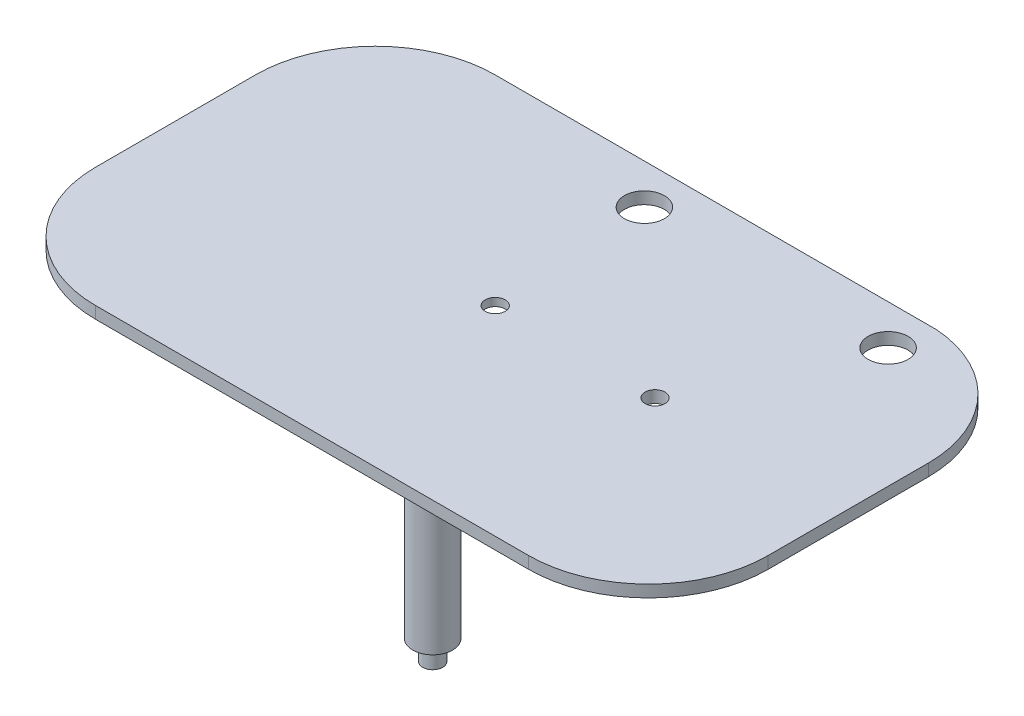
from build123d import *

# Parameters (mm, degrees)
EXTRUDE_1_DEPTH           = 50
EXTRUDE_1_DEPTH_BACK      = 50
SKETCH_2_W                = 200
SKETCH_2_H                = 100
EXTRUDE_2_DEPTH           = 40
SKETCH_3_W                = 200
SKETCH_3_H                = 34
CUT_EXTRUDE_1_DEPTH       = 100
CUT_EXTRUDE_2_DEPTH       = 279.66871012
SKETCH_8_R                = 2.5
CUT_EXTRUDE_4_DEPTH       = 276.238532913
SKETCH_10_R               = 5
CUT_EXTRUDE_5_DEPTH       = 260.608358879
EXTRUDE_5_DEPTH           = 10
SKETCH_13_W               = 74.115787845
SKETCH_13_H               = 3
EXTRUDE_7_DEPTH           = 81
SKETCH_14_W               = 207.5
SKETCH_14_H               = 100
EXTRUDE_8_DEPTH           = 7
EXTRUDE_9_DEPTH           = 10
SKETCH_17_R               = 6.35
CUT_EXTRUDE_6_DEPTH       = 1
CUT_EXTRUDE_START         = -1
SKETCH_18_R               = 6.35
CUT_EXTRUDE_7_DEPTH       = 1
SKETCH_20_R               = 5
CUT_EXTRUDE_8_DEPTH       = 3
CUT_EXTRUDE_9_DEPTH       = 273.255129638
CUT_EXTRUDE_9_DEPTH_BACK  = 273.255129638
SKETCH_21_W               = 31.665374736
SKETCH_21_H               = 100
SKETCH_22_R               = 5
EXTRUDE_10_DEPTH          = 37
FILLET_1_R                = 30
FILLET_2_R                = 30
CUT_EXTRUDE_10_DEPTH      = 248.444254611
CUT_EXTRUDE_10_DEPTH_BACK = 248.444254611
CUT_EXTRUDE_11_DEPTH      = 211.689689342
CUT_EXTRUDE_11_DEPTH_BACK = 211.689689342
CUT_EXTRUDE_12_DEPTH      = 174.368632309
CUT_EXTRUDE_12_DEPTH_BACK = 174.368632309
SKETCH_26_R               = 5
CUT_EXTRUDE_13_DEPTH      = 153.295269567
CUT_EXTRUDE_13_DEPTH_BACK = 153.295269567
CUT_EXTRUDE_14_DEPTH      = 160.286168691
CUT_EXTRUDE_14_DEPTH_BACK = 160.286168691
SKETCH_30_R               = 7.5
CUT_EXTRUDE_15_DEPTH      = 160.286168691
CUT_EXTRUDE_15_DEPTH_BACK = 160.286168691
SKETCH_31_R               = 7.5
SKETCH_31_R_2             = 5
SKETCH_32_R               = 7.5
SKETCH_32_R_2             = 5
EXTRUDE_12_DEPTH          = 3
SKETCH_33_R               = 7.5
SKETCH_33_R_2             = 5
EXTRUDE_13_DEPTH          = 3
SKETCH_34_R               = 5
EXTRUDE_14_DEPTH          = 45
CUT_EXTRUDE_17_DEPTH      = 178.031776809
CUT_EXTRUDE_17_DEPTH_BACK = 178.031776809
SKETCH_37_W               = 132.207085757
SKETCH_37_H               = 67.753693261
EXTRUDE_19_DEPTH          = 34
SKETCH_44_R               = 2.5
EXTRUDE_20_DEPTH          = 5
SKETCH_41_R               = 7.5
SKETCH_41_R_2             = 5
EXTRUDE_17_DEPTH          = 3
SKETCH_42_R               = 7.5
SKETCH_42_R_2             = 5
EXTRUDE_18_DEPTH          = 3


with BuildPart() as part:
    # 草图1 → 凸台-拉伸1 (new, two sides: drawn at the far end of the back side and taken through both)
    with BuildSketch(Plane(origin=(0, 0, 0), x_dir=(1, 0, 0), z_dir=(0, 1, 0)).offset(-EXTRUDE_1_DEPTH_BACK)):
        Polygon((9.5, 12.5), (9.5, 0), (90.5, 0), (90.5, 12.5), (90.5, 212.5), (9.5, 212.5), align=None)
    extrude(amount=EXTRUDE_1_DEPTH + EXTRUDE_1_DEPTH_BACK)

    # 草图2 → 凸台-拉伸2 (add)
    with BuildSketch(Plane(origin=(0, 0, 0), x_dir=(-1, 0, 0), z_dir=(0, -1, 0))):
        with Locations((-50, -50)):
            Rectangle(SKETCH_2_W, SKETCH_2_H)
    extrude(amount=-EXTRUDE_2_DEPTH)

    # 草图3 → 切除-拉伸1 (cut)
    with BuildSketch(Plane.XY.offset(100)):
        with Locations((50, 20)):
            Rectangle(SKETCH_3_W, SKETCH_3_H)
    extrude(amount=-CUT_EXTRUDE_1_DEPTH, mode=Mode.SUBTRACT)

    # 草图6 → 切除-拉伸2 (cut, through all)
    with BuildSketch(Plane(origin=(0, 50, 0), x_dir=(1, 0, 0), z_dir=(0, 1, 0))):
        Polygon((12.5, 905.325014188), (12.5, 212.5), (12.5, 5), (87.5, 5), (87.5, 212.5), (87.5, 905.325014188), (87.5, 2290.975042562), (12.5, 2290.975042562), align=None)
    extrude(amount=-CUT_EXTRUDE_2_DEPTH, mode=Mode.SUBTRACT)

    # 草图8 → 切除-拉伸4 (cut, through all)
    with BuildSketch(Plane(origin=(0, 40, 0), x_dir=(1, 0, 0), z_dir=(0, 1, 0))):
        with Locations(Location((70, -50, 0), (0, 0, 270))):
            Circle(SKETCH_8_R)
        with Locations(Location((30, -50, 0), (0, 0, 270))):
            Circle(SKETCH_8_R)
    extrude(amount=-CUT_EXTRUDE_4_DEPTH, mode=Mode.SUBTRACT)

    # 草图10 → 切除-拉伸5 (cut, through all)
    with BuildSketch(Plane(origin=(90.5, 0, 0), x_dir=(0, 0, -1), z_dir=(1, 0, 0))):
        with Locations((80, 0)):
            Circle(SKETCH_10_R)
        with Locations((180, 0)):
            Circle(SKETCH_10_R)
    extrude(amount=-CUT_EXTRUDE_5_DEPTH, mode=Mode.SUBTRACT)

    # 草图11 → 凸台-拉伸5 (add)
    with BuildSketch(Plane.ZY.offset(-9.5)):
        Polygon((-30.905613639, 83.415207604), (-74.094429483, 50), (0, 50), (0, 40), (83.32101017, 40), align=None)
    extrude(amount=-EXTRUDE_5_DEPTH)

    # 草图13 → 凸台-拉伸7 (add)
    with BuildSketch(Plane(origin=(90.5, 0, 0), x_dir=(0, 0, -1), z_dir=(1, 0, 0))):
        with Locations((37.057893922, 51.5)):
            Rectangle(SKETCH_13_W, SKETCH_13_H)
    extrude(amount=-EXTRUDE_7_DEPTH)

    # 草图14 → 凸台-拉伸8 (add)
    with BuildSketch(Plane(origin=(12.5, 0, 0), x_dir=(0, 0, -1), z_dir=(1, 0, 0))):
        with Locations((108.75, 0)):
            Rectangle(SKETCH_14_W, SKETCH_14_H)
    extrude(amount=EXTRUDE_8_DEPTH)

    # 草图15 → 凸台-拉伸9 (add)
    with BuildSketch(Plane(origin=(90.5, 0, 0), x_dir=(0, 0, -1), z_dir=(1, 0, 0))):
        Polygon((30.905613639, 83.415207604), (-82.902171575, 40), (0, 40), (0, 53), (70.216960007, 53), align=None)
    extrude(amount=-EXTRUDE_9_DEPTH)

    # 草图17 → 切除-拉伸6 (cut)
    with BuildSketch(Plane(origin=(0, 37, 0), x_dir=(-1, 0, 0), z_dir=(0, -1, 0))):
        with Locations(Location((-30, -50, 0), (0, 0, 90))):
            Circle(SKETCH_17_R)
    extrude(amount=-CUT_EXTRUDE_6_DEPTH, mode=Mode.SUBTRACT)

    # 草图18 → 切除-拉伸7 (cut)
    with BuildSketch(Plane(origin=(0, 3, 0), x_dir=(1, 0, 0), z_dir=(0, 1, 0)).offset(CUT_EXTRUDE_START)):
        with Locations(Location((30, -50, 0), (0, 0, 90))):
            Circle(SKETCH_18_R)
    extrude(amount=CUT_EXTRUDE_7_DEPTH, mode=Mode.SUBTRACT)

    # 草图20 → 切除-拉伸8 (cut)
    with BuildSketch(Plane.XZ):
        with Locations(Location((-31.25, 50, 0), (0, 0, 270))):
            Circle(SKETCH_20_R)
        with Locations(Location((91.25, 50, 0), (0, 0, 270))):
            Circle(SKETCH_20_R)
    extrude(amount=-CUT_EXTRUDE_8_DEPTH, mode=Mode.SUBTRACT)

    # 草图21 → 切除-拉伸9 (cut, two sides: drawn at the far end of the back side and taken through both)
    with BuildSketch(Plane(origin=(0, 3, 0), x_dir=(1, 0, 0), z_dir=(0, 1, 0)).offset(-CUT_EXTRUDE_9_DEPTH_BACK)):
        with Locations((134.167312632, -50)):
            Rectangle(SKETCH_21_W, SKETCH_21_H)
    extrude(amount=CUT_EXTRUDE_9_DEPTH + CUT_EXTRUDE_9_DEPTH_BACK, mode=Mode.SUBTRACT)

    # 草图22 → 凸台-拉伸10 (add)
    with BuildSketch(Plane.XZ):
        with Locations((-28.834995313, 14.93844285)):
            Circle(SKETCH_22_R)
        with Locations((99.943738589, 14.93844285)):
            Circle(SKETCH_22_R)
        with Locations((47.358621855, 88.902784002)):
            Circle(SKETCH_22_R)
    extrude(amount=-EXTRUDE_10_DEPTH)

    # 圆角1
    # the kernel refuses this fillet: 30 mm, written as the material it takes off along each edge
    with BuildSketch(Plane(origin=(-32.536340759, 83.415207604, -30.905613639), x_dir=(0, -0.6119293356637439, -0.7909124402575352), z_dir=(1, 0, 0))) as fillet_1_piece_1:
        with BuildLine():
            CenterArc((FILLET_1_R * 0.560484543454, -FILLET_1_R), FILLET_1_R, 90, 58.539912966)
            Line((-FILLET_1_R * 0.292519393108, -FILLET_1_R * 0.478095521948), (-FILLET_1_R * 0.309579471839, -FILLET_1_R * 0.467657432387))
            Line((-FILLET_1_R * 0.309579471839, -FILLET_1_R * 0.467657432387), (-FILLET_1_R * 0.0112096908691, FILLET_1_R * 0.02))
            Line((-FILLET_1_R * 0.0112096908691, FILLET_1_R * 0.02), (FILLET_1_R * 0.560484543454, FILLET_1_R * 0.02))
            Line((FILLET_1_R * 0.560484543454, FILLET_1_R * 0.02), (FILLET_1_R * 0.560484543454, 0))
        make_face()
    extrude(amount=94.072681518, mode=Mode.SUBTRACT)
    with BuildSketch(Plane(origin=(132.596564701, 83.415207604, -30.905613639), x_dir=(0, -0.6119293356637436, -0.7909124402575354), z_dir=(-1, 0, 0))) as fillet_1_piece_2:
        with BuildLine():
            CenterArc((FILLET_1_R * 0.561287529341, FILLET_1_R), FILLET_1_R, 211.390091687, 58.609908313)
            Line((-FILLET_1_R * 0.292353354769, FILLET_1_R * 0.479137982787), (-FILLET_1_R * 0.309426172451, FILLET_1_R * 0.468720742443))
            Line((-FILLET_1_R * 0.309426172451, FILLET_1_R * 0.468720742443), (-FILLET_1_R * 0.0112257505868, -FILLET_1_R * 0.02))
            Line((-FILLET_1_R * 0.0112257505868, -FILLET_1_R * 0.02), (FILLET_1_R * 0.561287529341, -FILLET_1_R * 0.02))
            Line((FILLET_1_R * 0.561287529341, -FILLET_1_R * 0.02), (FILLET_1_R * 0.561287529341, 0))
        make_face()
    extrude(amount=94.193129401, mode=Mode.SUBTRACT)
    with BuildSketch(Plane(origin=(118.334625264, -38, 100), x_dir=(-1, 0, 0), z_dir=(0, 1, 0)), Plane(origin=(118.334625264, -75, 100), x_dir=(-1, 0, 0), z_dir=(0, 1, 0)), Plane(origin=(-50, -38, 0), x_dir=(1, 0, 0), z_dir=(0, 1, 0)), Plane(origin=(-50, -38, 100), x_dir=(0, 0, -1), z_dir=(0, 1, 0)), Plane(origin=(-50, -75, 100), x_dir=(0, 0, -1), z_dir=(0, 1, 0)), Plane(origin=(-50, -75, 0), x_dir=(1, 0, 0), z_dir=(0, 1, 0))) as fillet_1_piece_3:
        with BuildLine():
            CenterArc((FILLET_1_R, -FILLET_1_R), FILLET_1_R, 90, 90)
            Line((0, -FILLET_1_R), (-FILLET_1_R * 0.02, -FILLET_1_R))
            Line((-FILLET_1_R * 0.02, -FILLET_1_R), (-FILLET_1_R * 0.02, FILLET_1_R * 0.02))
            Line((-FILLET_1_R * 0.02, FILLET_1_R * 0.02), (FILLET_1_R, FILLET_1_R * 0.02))
            Line((FILLET_1_R, FILLET_1_R * 0.02), (FILLET_1_R, 0))
        make_face()
    extrude(amount=153, mode=Mode.SUBTRACT)
    with BuildSketch(Plane(origin=(118.334625264, 114.804376219, 0), x_dir=(0, 0, 1), z_dir=(0, -1, 0))) as fillet_1_piece_4:
        with BuildLine():
            CenterArc((29.921750488, 30), FILLET_1_R, 184.139160489, 85.860839511)
            Line((0, 27.834625264), (-0.59843501, 27.791317769))
            ThreePointArc((-0.59843501, 27.791317769), (-0.6, 13.917312632), (-0.6, 0))
            Line((-0.6, 0), (0, -0.6))
            Line((0, -0.6), (29.921750488, -0.6))
            Line((29.921750488, -0.6), (29.921750488, 0))
        make_face()
    extrude(amount=152.608752439, mode=Mode.SUBTRACT)
    with BuildSketch(Plane(origin=(118.334625264, 77.804376219, 0), x_dir=(-1, 0, 0), z_dir=(0, -1, 0))) as fillet_1_piece_5:
        with BuildLine():
            CenterArc((30, -29.921750488), FILLET_1_R, 94.139160489, 85.860839511)
            Line((0, -29.921750488), (-0.6, -29.921750488))
            Line((-0.6, -29.921750488), (-0.6, 0))
            Line((-0.6, 0), (0, 0.6))
            ThreePointArc((0, 0.6), (13.917312632, 0.6), (27.791317769, 0.59843501))
            Line((27.791317769, 0.59843501), (27.834625264, 0))
        make_face()
    extrude(amount=152.608752439, mode=Mode.SUBTRACT)

    # 圆角2
    fillet_2_edges = [part.edges().sort_by_distance(p)[0] for p in [
        (89, 50, -212.5),
        (89, -50, -212.5),
        (14.5, 50, -212.5),
        (14.5, -50, -212.5),
    ]]
    fillet(fillet_2_edges, radius=FILLET_2_R)

    # 草图23 → 切除-拉伸10 (cut, two sides: drawn at the far end of the back side and taken through both)
    with BuildSketch(Plane(origin=(19.5, 0, 0), x_dir=(0, 0, -1), z_dir=(1, 0, 0)).offset(-CUT_EXTRUDE_10_DEPTH_BACK)):
        Polygon((-82.902171575, 40), (15.172878857, 77.413509693), (30.26062931, 83.169160038), (82.911746167, 53.484816406), (216.982404769, 51.400816531), (216.982404769, -53.030732743), (0, -55.346288159), (0, 40), align=None)
    extrude(amount=CUT_EXTRUDE_10_DEPTH + CUT_EXTRUDE_10_DEPTH_BACK, mode=Mode.SUBTRACT)

    # 草图25 → 切除-拉伸11 (cut, two sides: drawn at the far end of the back side and taken through both)
    with BuildSketch(Plane(origin=(118.334625264, 0, 0), x_dir=(0, 0, -1), z_dir=(1, 0, 0)).offset(-CUT_EXTRUDE_11_DEPTH_BACK)):
        Polygon((-96.999238457, 37), (-5.714105567, 37), (-5.714105567, 3), (-98.622428797, 3), align=None)
    extrude(amount=CUT_EXTRUDE_11_DEPTH + CUT_EXTRUDE_11_DEPTH_BACK, mode=Mode.SUBTRACT)


with BuildPart() as cut_extrude_11_piece_1:
    # of the separate pieces the step leaves, piece 1, a body of its own (cut_extrude_11_pieces)
    add(part.part.solids().sort_by_distance((118.334625264, 37, 70))[0])


with BuildPart() as cut_extrude_11_piece_2:
    # of the separate pieces the step leaves, piece 2, a body of its own (cut_extrude_11_pieces)
    add(part.part.solids().sort_by_distance((-20, 0, 0))[0])


with BuildPart() as cut_extrude_12_tool:
    # 草图26 → 切除-拉伸12 (new, two sides: drawn at the far end of the back side and taken through both)
    with BuildSketch(Plane.XZ.offset(-CUT_EXTRUDE_12_DEPTH_BACK)):
        with Locations(Location((88.334625264, 10, 0), (0, 0, 270))):
            Circle(SKETCH_26_R)
        with Locations(Location((27.334625264, 10, 0), (0, 0, 270))):
            Circle(SKETCH_26_R)
    extrude(amount=CUT_EXTRUDE_12_DEPTH + CUT_EXTRUDE_12_DEPTH_BACK)


with BuildPart() as cut_extrude_11_piece_1_1:
    add(cut_extrude_11_piece_1.part)

    # 切除-拉伸12: cut by cut_extrude_12_tool
    add(cut_extrude_12_tool.part, mode=Mode.SUBTRACT)

    # 草图27 → 切除-拉伸13 (cut, two sides: drawn at the far end of the back side and taken through both)
    with BuildSketch(Plane.ZY.offset(-34.5).offset(-CUT_EXTRUDE_13_DEPTH_BACK)):
        Polygon((-18.94184398, 81.696068066), (-17.663883038, 66.307288383), (80.739109538, 40), (87.341907742, 40), align=None)
    extrude(amount=CUT_EXTRUDE_13_DEPTH + CUT_EXTRUDE_13_DEPTH_BACK, mode=Mode.SUBTRACT)


with BuildPart() as cut_extrude_11_piece_2_1:
    add(cut_extrude_11_piece_2.part)

    # 切除-拉伸12: cut by cut_extrude_12_tool
    add(cut_extrude_12_tool.part, mode=Mode.SUBTRACT)


with BuildPart() as cut_extrude_14_tool:
    # 草图30 → 切除-拉伸14 (new, two sides: drawn at the far end of the back side and taken through both)
    with BuildSketch(Plane.XZ.offset(-37).offset(-CUT_EXTRUDE_14_DEPTH_BACK)):
        with Locations(Location((88.334625264, 10, 0), (0, 0, 270))):
            Circle(SKETCH_30_R)
    extrude(amount=CUT_EXTRUDE_14_DEPTH + CUT_EXTRUDE_14_DEPTH_BACK)


with BuildPart() as cut_extrude_11_piece_1_2:
    add(cut_extrude_11_piece_1_1.part)

    # 切除-拉伸14: cut by cut_extrude_14_tool
    add(cut_extrude_14_tool.part, mode=Mode.SUBTRACT)


with BuildPart() as cut_extrude_11_piece_2_2:
    add(cut_extrude_11_piece_2_1.part)

    # 切除-拉伸14: cut by cut_extrude_14_tool
    add(cut_extrude_14_tool.part, mode=Mode.SUBTRACT)


with BuildPart() as cut_extrude_15_tool:
    # 草图31 → 切除-拉伸15 (new, two sides: drawn at the far end of the back side and taken through both)
    with BuildSketch(Plane.XZ.offset(-37).offset(-CUT_EXTRUDE_15_DEPTH_BACK)):
        with Locations(Location((27.334625264, 10, 0), (0, 0, 270))):
            Circle(SKETCH_31_R)
        with Locations((27.334625264, 10)):
            Circle(SKETCH_31_R_2, mode=Mode.SUBTRACT)
    extrude(amount=CUT_EXTRUDE_15_DEPTH + CUT_EXTRUDE_15_DEPTH_BACK)


with BuildPart() as cut_extrude_11_piece_1_3:
    add(cut_extrude_11_piece_1_2.part)

    # 切除-拉伸15: cut by cut_extrude_15_tool
    add(cut_extrude_15_tool.part, mode=Mode.SUBTRACT)



with BuildPart() as cut_extrude_11_piece_2_3:
    add(cut_extrude_11_piece_2_2.part)

    # 切除-拉伸15: cut by cut_extrude_15_tool
    add(cut_extrude_15_tool.part, mode=Mode.SUBTRACT)

    # 草图32 → 凸台-拉伸12 (add)
    with BuildSketch(Plane.XZ):
        with Locations(Location((27.334625264, 10, 0), (0, 0, 270))):
            Circle(SKETCH_32_R)
        with Locations(Location((27.334625264, 10, 0), (0, 0, 270))):
            Circle(SKETCH_32_R_2, mode=Mode.SUBTRACT)
    extrude(amount=-EXTRUDE_12_DEPTH)

    # 草图33 → 凸台-拉伸13 (add)
    with BuildSketch(Plane.XZ):
        with Locations(Location((88.334625264, 10, 0), (0, 0, 270))):
            Circle(SKETCH_33_R)
        with Locations(Location((88.334625264, 10, 0), (0, 0, 270))):
            Circle(SKETCH_33_R_2, mode=Mode.SUBTRACT)
    extrude(amount=-EXTRUDE_13_DEPTH)


with BuildPart() as cut_extrude_11_piece_1_4:
    add(cut_extrude_11_piece_1_3.part)

    add(cut_extrude_11_piece_2_3.part)  # 凸台-拉伸14 merges 切除-拉伸11 piece 2
    # 草图34 → 凸台-拉伸14 (add)
    with BuildSketch(Plane.XZ.offset(-37)):
        with Locations(Location((57.356592352, 86.553493229, 0), (0, 0, 90))):
            Circle(SKETCH_34_R)
    extrude(amount=EXTRUDE_14_DEPTH)

    # 草图37 → 切除-拉伸17 (cut, two sides: drawn at the far end of the back side and taken through both)
    with BuildSketch(Plane(origin=(90.5, 0, 0), x_dir=(0, 0, -1), z_dir=(1, 0, 0)).offset(-CUT_EXTRUDE_17_DEPTH_BACK)):
        with Locations((-61.671884505, 3.123153369)):
            Rectangle(SKETCH_37_W, SKETCH_37_H)
    extrude(amount=CUT_EXTRUDE_17_DEPTH + CUT_EXTRUDE_17_DEPTH_BACK, mode=Mode.SUBTRACT)

    # 草图43 → 凸台-拉伸19 (add)
    with BuildSketch(Plane.XZ.offset(-37)):
        with BuildLine():
            ThreePointArc((57.356592352, 98), (52.356592352, 93), (57.356592352, 88))
            Line((57.356592352, 88), (57.356592352, 98))
        make_face()
        with BuildLine():
            Line((57.356592352, 98), (57.356592352, 88))
            ThreePointArc((57.356592352, 88), (60.892126258, 89.464466094), (62.356592352, 93))
            ThreePointArc((62.356592352, 93), (60.892126258, 96.535533906), (57.356592352, 98))
        make_face()
    extrude(amount=EXTRUDE_19_DEPTH)

    # 草图44 → 凸台-拉伸20 (add)
    with BuildSketch(Plane.XZ.offset(-3)):
        with Locations(Location((57.356592352, 93, 0), (0, 0, 270))):
            Circle(SKETCH_44_R)
    extrude(amount=EXTRUDE_20_DEPTH)

    # 草图41 → 凸台-拉伸17 (add)
    with BuildSketch(Plane.XZ.offset(-37)):
        with Locations((27.334625264, 10)):
            Circle(SKETCH_41_R)
        with Locations(Location((27.334625264, 10, 0), (0, 0, 270))):
            Circle(SKETCH_41_R_2, mode=Mode.SUBTRACT)
    extrude(amount=-EXTRUDE_17_DEPTH)

    # 草图42 → 凸台-拉伸18 (add)
    with BuildSketch(Plane.XZ.offset(-37)):
        with Locations((88.334625264, 10)):
            Circle(SKETCH_42_R)
        with Locations(Location((88.334625264, 10, 0), (0, 0, 270))):
            Circle(SKETCH_42_R_2, mode=Mode.SUBTRACT)
    extrude(amount=-EXTRUDE_18_DEPTH)


solid = cut_extrude_11_piece_1_4.part
